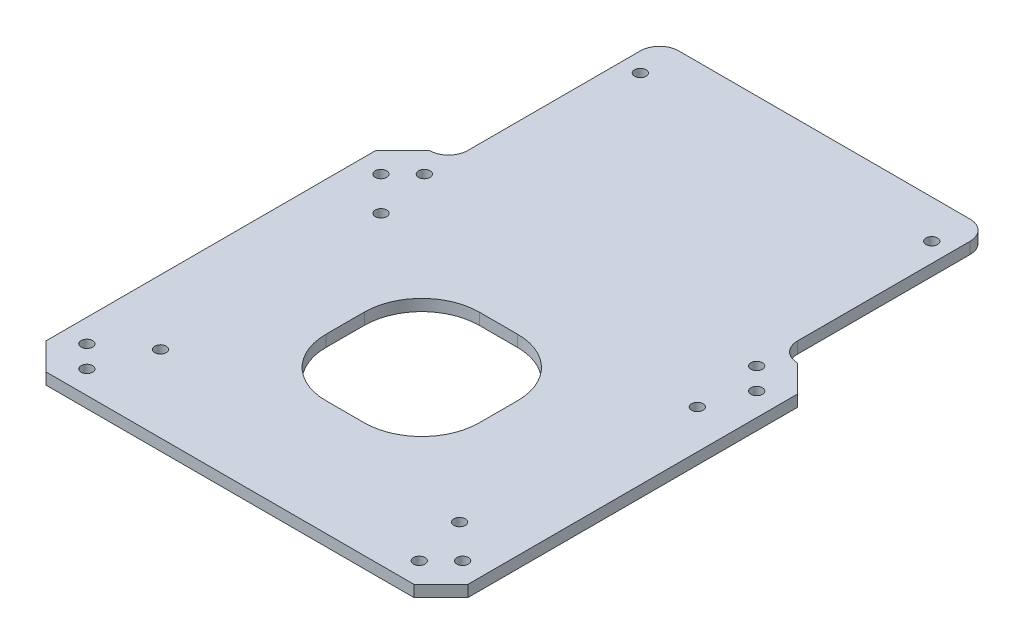
from build123d import *

# Parameters (mm, degrees)
SKETCH_1_R          = 1.5
EXTRUDE_1_DEPTH     = 3
CHAMFER_1_SIZE      = 7
FILLET_START        = -1
FILLET_1_DEPTH      = 5
FILLET_1_2_DEPTH    = 3
SKETCH_3_R          = 1.5
SKETCH_3_W          = 40
SKETCH_3_H          = 40
CUT_EXTRUDE_1_DEPTH = 3
FILLET_2_R          = 15


with BuildPart() as part:
    # 草图1 → 凸台-拉伸1 (new body)
    with BuildSketch(Plane(origin=(0, 0, 0), x_dir=(1, 0, 0), z_dir=(0, 1, 0))):
        Polygon((-55, 50), (-55, -50), (55, -50), (55, 50), (43, 50), (43, 105), (-43, 105), (-43, 50), align=None)
        with Locations(Location((-43.343145751, -44, 0), (0, 0, 270))):
            Circle(SKETCH_1_R, mode=Mode.SUBTRACT)
        with Locations(Location((-49, -38.343145751, 0), (0, 0, 270))):
            Circle(SKETCH_1_R, mode=Mode.SUBTRACT)
        with Locations(Location((43.343145751, -44, 0), (0, 0, 270))):
            Circle(SKETCH_1_R, mode=Mode.SUBTRACT)
        with Locations(Location((49, -38.343145751, 0), (0, 0, 270))):
            Circle(SKETCH_1_R, mode=Mode.SUBTRACT)
        with Locations(Location((-49, 38.343145751, 0), (0, 0, 270))):
            Circle(SKETCH_1_R, mode=Mode.SUBTRACT)
        with Locations(Location((-43.343145751, 44, 0), (0, 0, 270))):
            Circle(SKETCH_1_R, mode=Mode.SUBTRACT)
        with Locations(Location((43.343145751, 44, 0), (0, 0, 270))):
            Circle(SKETCH_1_R, mode=Mode.SUBTRACT)
        with Locations(Location((49, 38.343145751, 0), (0, 0, 270))):
            Circle(SKETCH_1_R, mode=Mode.SUBTRACT)
        with Locations(Location((38, 95, 0), (0, 0, 270))):
            Circle(SKETCH_1_R, mode=Mode.SUBTRACT)
        with Locations(Location((-38, 95, 0), (0, 0, 270))):
            Circle(SKETCH_1_R, mode=Mode.SUBTRACT)
    extrude(amount=EXTRUDE_1_DEPTH)

    # 倒角1
    chamfer_1_edges = [part.edges().sort_by_distance(p)[0] for p in [
        (-55, 1.5, 50),
        (-55, 1.5, -50),
        (55, 1.5, -50),
        (55, 1.5, 50),
    ]]
    chamfer(chamfer_1_edges, length=CHAMFER_1_SIZE)

    # 圆角1: read off the stored shape, not the designer's step
    # 圆角1 outline → 圆角1 (cut)
    with BuildSketch(Plane(origin=(0, 0, 0), x_dir=(1, 0, 0), z_dir=(0, 1, 0)).offset(FILLET_START)):
        with BuildLine():
            ThreePointArc((-43, 100), (-41.535533906, 103.535533906), (-38, 105))
            Line((-38, 105), (-43, 105))
            Line((-43, 105), (-43, 100))
        make_face()
        with BuildLine():
            ThreePointArc((38, 105), (41.535533906, 103.535533906), (43, 100))
            Line((43, 100), (43, 105))
            Line((43, 105), (38, 105))
        make_face()
    extrude(amount=FILLET_1_DEPTH, mode=Mode.SUBTRACT)

    # Fillet 1 2 outline → Fillet 1 2 (add)
    with BuildSketch(Plane(origin=(0, 0, 0), x_dir=(1, 0, 0), z_dir=(0, 1, 0))):
        with BuildLine():
            Line((43, 50), (48, 50))
            ThreePointArc((48, 50), (44.464466094, 51.464466094), (43, 55))
            Line((43, 55), (43, 50))
        make_face()
        with BuildLine():
            Line((-43, 50), (-43, 55))
            ThreePointArc((-43, 55), (-44.464466094, 51.464466094), (-48, 50))
            Line((-48, 50), (-43, 50))
        make_face()
    extrude(amount=FILLET_1_2_DEPTH)

    # 草图3 → 切除-拉伸1 (cut)
    with BuildSketch(Plane(origin=(0, 3, 0), x_dir=(1, 0, 0), z_dir=(0, 1, 0))):
        with Locations(Location((-40.14, 29.5, 0), (0, 0, 270))):
            Circle(SKETCH_3_R)
        with Locations(Location((44.86, 27, 0), (0, 0, 270))):
            Circle(SKETCH_3_R)
        with Locations(Location((-38.14, -30, 0), (0, 0, 270))):
            Circle(SKETCH_3_R)
        with Locations(Location((39.86, -30, 0), (0, 0, 270))):
            Circle(SKETCH_3_R)
        Rectangle(SKETCH_3_W, SKETCH_3_H)
    extrude(amount=-CUT_EXTRUDE_1_DEPTH, mode=Mode.SUBTRACT)

    # 圆角2
    fillet_2_edges = [part.edges().sort_by_distance(p)[0] for p in [
        (20, 1.5, -20),
        (20, 1.5, 20),
        (-20, 1.5, 20),
        (-20, 1.5, -20),
    ]]
    fillet(fillet_2_edges, radius=FILLET_2_R)


solid = part.part
